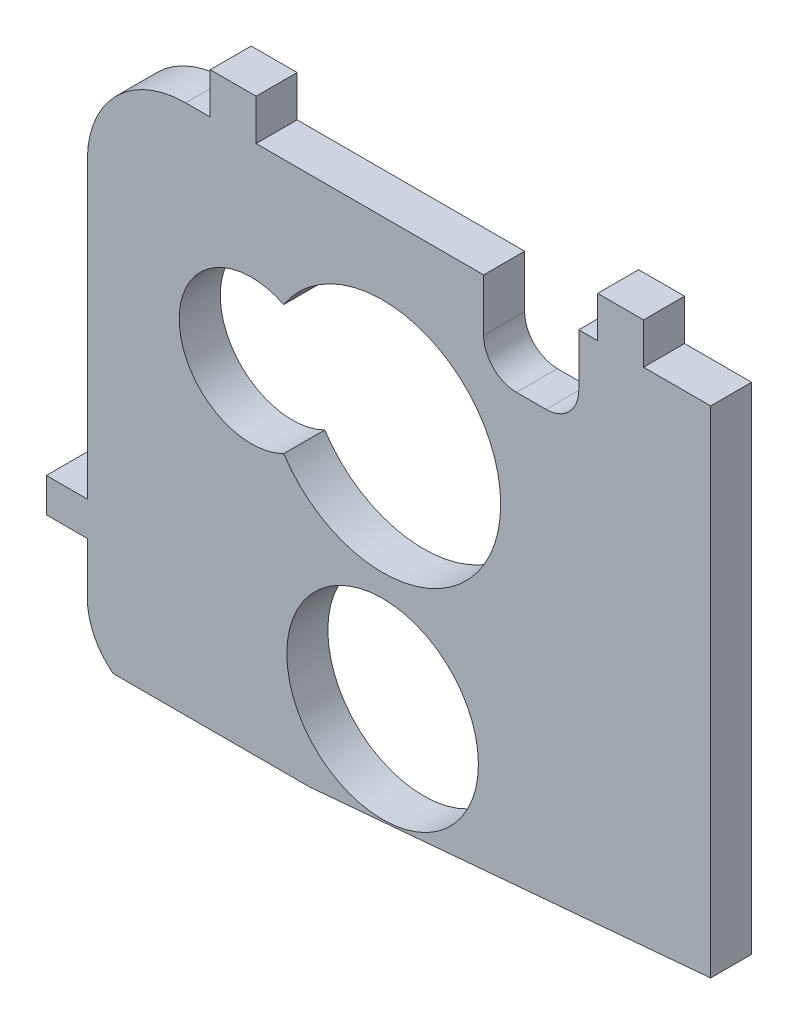
from build123d import *

# Parameters (mm, degrees)
SKETCH1_R           = 3.7084
BOSS_EXTRUDE1_DEPTH = 1.5875
SKETCH3_W           = 3.683
SKETCH3_H           = 3.302
CUT_EXTRUDE1_DEPTH  = 23.34938408
FILLET1_R           = 1.27


with BuildPart() as part:
    # Sketch1 → Boss-Extrude1 (new body)
    with BuildSketch(Plane.XY):
        with BuildLine():
            Line((-10.431265191, -4.028360607), (-2.823309713, -4.028360607))
            Line((-2.823309713, -4.028360607), (12.7, -2.670246987))
            Line((12.7, -2.670246987), (12.7, 16.51))
            Line((12.7, 16.51), (10.10362126, 16.51))
            Line((10.10362126, 16.51), (10.10362126, 18.0975))
            Line((10.10362126, 18.0975), (8.32562126, 18.0975))
            Line((8.32562126, 18.0975), (8.32562126, 16.51))
            Line((8.32562126, 16.51), (-4.89637874, 16.51))
            Line((-4.89637874, 16.51), (-4.89637874, 18.0975))
            Line((-4.89637874, 18.0975), (-6.67437874, 18.0975))
            Line((-6.67437874, 18.0975), (-6.67437874, 16.51))
            Line((-6.67437874, 16.51), (-7.62, 16.51))
            ThreePointArc((-7.62, 16.51), (-10.314076836, 15.394076836), (-11.43, 12.7))
            Line((-11.43, 12.7), (-11.43, 1.3208))
            Line((-11.43, 1.3208), (-13.0175, 1.3208))
            Line((-13.0175, 1.3208), (-13.0175, 0))
            Line((-13.0175, 0), (-11.43, 0))
            Line((-11.43, 0), (-11.43, -2.009424845))
            ThreePointArc((-11.43, -2.009424845), (-11.166665718, -3.135654487), (-10.431265191, -4.028360607))
        make_face()
        Circle(SKETCH1_R, mode=Mode.SUBTRACT)
        with BuildLine():
            ThreePointArc((-3.82905, 11.642311449), (4.572, 9.144), (-3.82905, 6.645688551))
            ThreePointArc((-3.82905, 6.645688551), (-7.874, 9.144), (-3.82905, 11.642311449))
        make_face(mode=Mode.SUBTRACT)
    extrude(amount=BOSS_EXTRUDE1_DEPTH)

    # Sketch3 → Cut-Extrude1 (cut, through all)
    with BuildSketch(Plane.XY.offset(1.5875)):
        with Locations((5.753177383, 14.859)):
            Rectangle(SKETCH3_W, SKETCH3_H)
    extrude(amount=-CUT_EXTRUDE1_DEPTH, mode=Mode.SUBTRACT)

    # Fillet1
    fillet1_edges = [part.edges().sort_by_distance(p)[0] for p in [
        (7.594677383, 13.208, 0.79375),
        (3.911677383, 13.208, 0.79375),
    ]]
    fillet(fillet1_edges, radius=FILLET1_R)


solid = part.part
